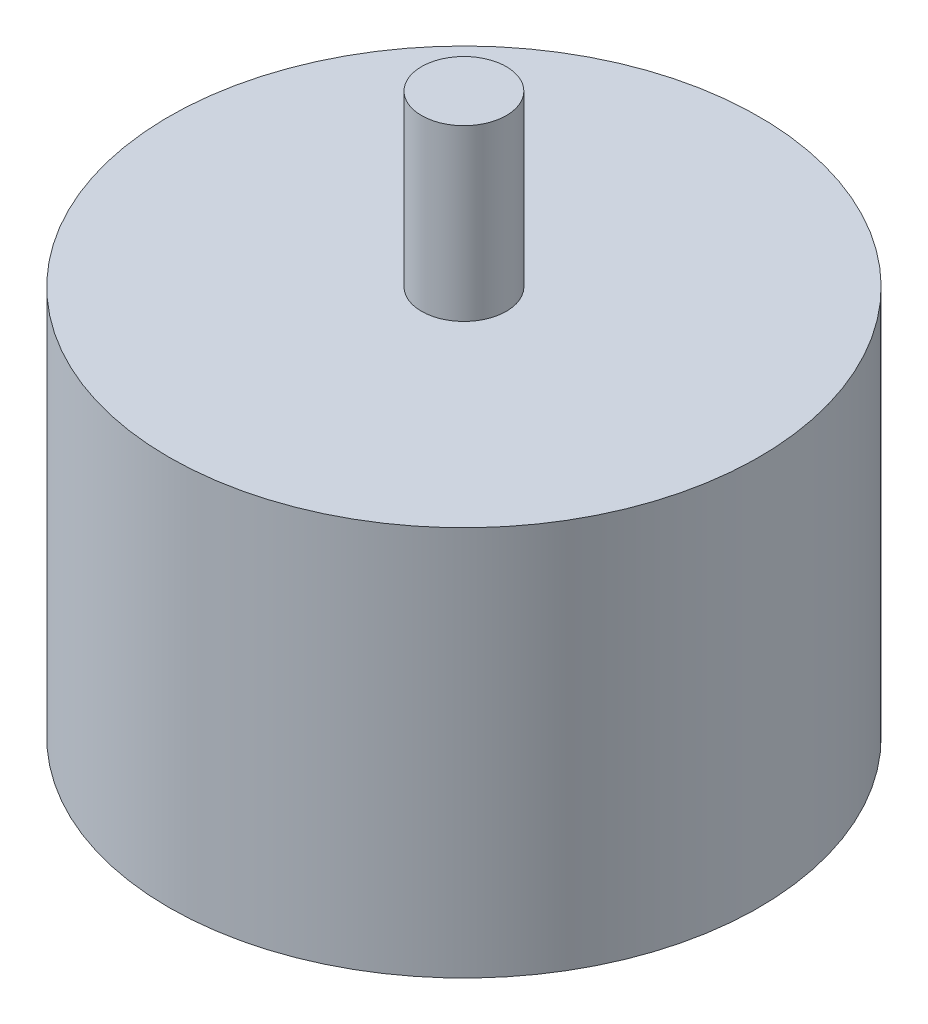
from build123d import *

# Parameters (mm, degrees)
SKETCH1_R           = 17.399
BOSS_EXTRUDE1_DEPTH = 23.0000048
SKETCH2_R           = 2.5
BOSS_EXTRUDE2_DEPTH = 10
SKETCH3_R           = 1.499997
BOSS_EXTRUDE3_DEPTH = 2
SKETCH4_R           = 1.524
SKETCH4_R_2         = 1.5
CUT_EXTRUDE1_DEPTH  = 2


with BuildPart() as part:
    # Sketch1 → Boss-Extrude1 (new body)
    with BuildSketch(Plane(origin=(0, 0, 0), x_dir=(1, 0, 0), z_dir=(0, 1, 0))):
        Circle(SKETCH1_R)
    extrude(amount=BOSS_EXTRUDE1_DEPTH)

    # Sketch2 → Boss-Extrude2 (add)
    with BuildSketch(Plane(origin=(0, 23.0000048, 0), x_dir=(1, 0, 0), z_dir=(0, 1, 0))):
        Circle(SKETCH2_R)
    extrude(amount=BOSS_EXTRUDE2_DEPTH)

    # Sketch3 → Boss-Extrude3 (add)
    with BuildSketch(Plane.XZ):
        Circle(SKETCH3_R)
    extrude(amount=BOSS_EXTRUDE3_DEPTH)

    # Sketch4 → Cut-Extrude1 (cut)
    with BuildSketch(Plane.XZ):
        with Locations((0, 12.5000004)):
            Circle(SKETCH4_R)
        with Locations((9.4999937, 0)):
            Circle(SKETCH4_R_2)
        with Locations((-9.4999937, 0)):
            Circle(SKETCH4_R_2)
        with Locations((0, -12.5000004)):
            Circle(SKETCH4_R)
    extrude(amount=-CUT_EXTRUDE1_DEPTH, mode=Mode.SUBTRACT)


solid = part.part
